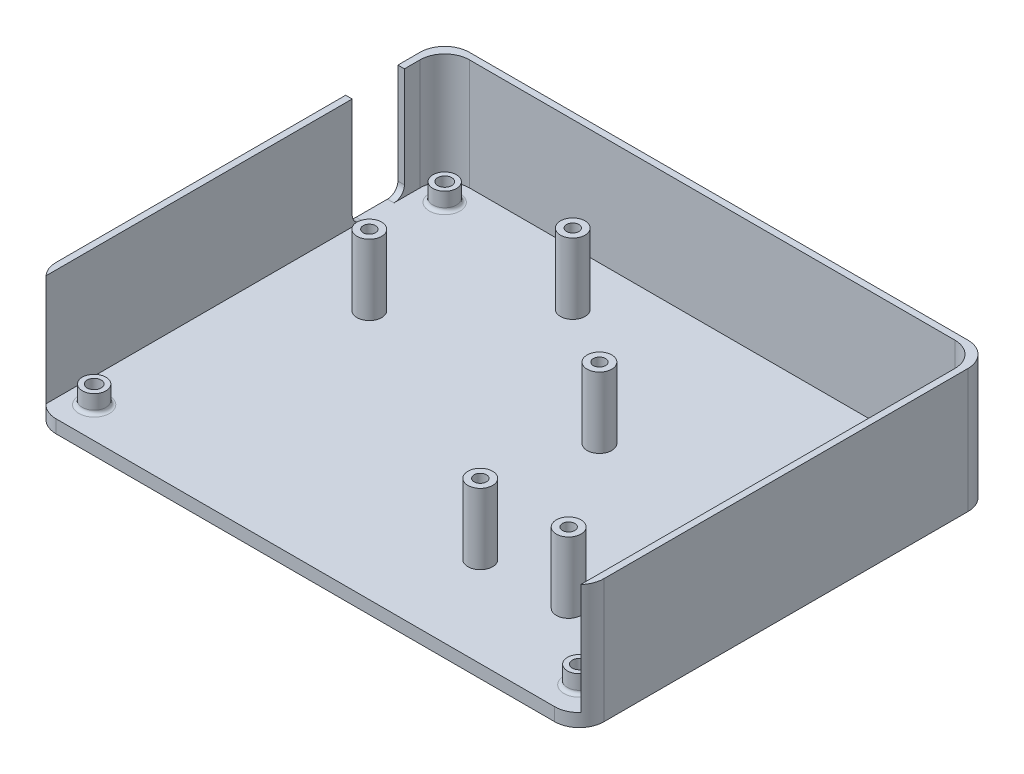
from build123d import *

# Parameters (mm, degrees)
BOSS_EXTRUDE12_DEPTH = 3.175
BOSS_EXTRUDE13_DEPTH = 30.1625
SKETCH1_25_R         = 2.875
SKETCH1_25_R_2       = 1.7
BOSS_EXTRUDE15_DEPTH = 7.525
SKETCH1_27_R         = 1.7
CUT_EXTRUDE3_DEPTH   = 28.575
CHAMFER2_SIZE        = 1.45
FILLET3_R            = 6
FILLET4_R            = 0.85
FILLET5_R            = 0.85
SKETCH2_W            = 12.7
SKETCH2_H            = 26.9875
CUT_EXTRUDE4_DEPTH   = 2.54
FILLET6_R            = 2.54
SKETCH1_30_R         = 3
SKETCH1_30_R_2       = 1.5
BOSS_EXTRUDE16_DEPTH = 20.32


with BuildPart() as part:
    # Sketch1 → Boss-Extrude12 (new body)
    with BuildSketch(Plane(origin=(0, 0, 0), x_dir=(1, 0, 0), z_dir=(0, 1, 0))):
        with BuildLine():
            Line((-66.858315384, -50.276221126), (-65.270815384, -50.276221126))
            Line((-65.270815384, -50.276221126), (64.85543465, -50.276221126))
            Line((64.85543465, -50.276221126), (66.44293465, -50.276221126))
            Line((66.44293465, -50.276221126), (66.44293465, 44.266274766))
            ThreePointArc((66.44293465, 44.266274766), (64.685575338, 48.508915454), (60.44293465, 50.266274766))
            Line((60.44293465, 50.266274766), (-60.858315384, 50.266274766))
            ThreePointArc((-60.858315384, 50.266274766), (-65.100956071, 48.508915454), (-66.858315384, 44.266274766))
            Line((-66.858315384, 44.266274766), (-66.858315384, -50.276221126))
        make_face()
    extrude(amount=BOSS_EXTRUDE12_DEPTH)

    # Sketch1<23> → Boss-Extrude13 (add)
    with BuildSketch(Plane(origin=(0, 0, 0), x_dir=(1, 0, 0), z_dir=(0, 1, 0))):
        with BuildLine():
            Line((-66.858315384, 44.266274766), (-66.858315384, -50.276221126))
            Line((-66.858315384, -50.276221126), (-65.270815384, -50.276221126))
            Line((-65.270815384, -50.276221126), (-65.270815384, 42.678774766))
            ThreePointArc((-65.270815384, 42.678774766), (-63.513456071, 46.921415454), (-59.270815384, 48.678774766))
            Line((-59.270815384, 48.678774766), (58.85543465, 48.678774766))
            ThreePointArc((58.85543465, 48.678774766), (63.098075338, 46.921415454), (64.85543465, 42.678774766))
            Line((64.85543465, 42.678774766), (64.85543465, -50.276221126))
            Line((64.85543465, -50.276221126), (66.44293465, -50.276221126))
            Line((66.44293465, -50.276221126), (66.44293465, 44.266274766))
            ThreePointArc((66.44293465, 44.266274766), (64.685575338, 48.508915454), (60.44293465, 50.266274766))
            Line((60.44293465, 50.266274766), (-60.858315384, 50.266274766))
            ThreePointArc((-60.858315384, 50.266274766), (-65.100956071, 48.508915454), (-66.858315384, 44.266274766))
        make_face()
    extrude(amount=BOSS_EXTRUDE13_DEPTH)

    # Sketch1<25> → Boss-Extrude15 (add)
    # profile 1 of 4: a face of its own
    with BuildSketch(Plane(origin=(0, 0, 0), x_dir=(1, 0, 0), z_dir=(0, 1, 0))):
        with Locations((-59.238315384, 42.646274766)):
            Circle(SKETCH1_25_R)
        with Locations((-59.238315384, 42.646274766)):
            Circle(SKETCH1_25_R_2, mode=Mode.SUBTRACT)
    # profile 2 of 4: a face of its own
    with BuildSketch(Plane(origin=(0, 0, 0), x_dir=(1, 0, 0), z_dir=(0, 1, 0))):
        with Locations((58.82293465, 42.646274766)):
            Circle(SKETCH1_25_R)
        with Locations((58.82293465, 42.646274766)):
            Circle(SKETCH1_25_R_2, mode=Mode.SUBTRACT)
    # profile 3 of 4: a face of its own
    with BuildSketch(Plane(origin=(0, 0, 0), x_dir=(1, 0, 0), z_dir=(0, 1, 0))):
        with Locations((-59.238315384, -42.656221126)):
            Circle(SKETCH1_25_R)
        with Locations((-59.238315384, -42.656221126)):
            Circle(SKETCH1_25_R_2, mode=Mode.SUBTRACT)
    # profile 4 of 4: a face of its own
    with BuildSketch(Plane(origin=(0, 0, 0), x_dir=(1, 0, 0), z_dir=(0, 1, 0))):
        with Locations((58.82293465, -42.656221126)):
            Circle(SKETCH1_25_R)
        with Locations((58.82293465, -42.656221126)):
            Circle(SKETCH1_25_R_2, mode=Mode.SUBTRACT)
    extrude(amount=BOSS_EXTRUDE15_DEPTH)

    # Sketch1<27> → Cut-Extrude3 (cut)
    with BuildSketch(Plane(origin=(0, 0, 0), x_dir=(1, 0, 0), z_dir=(0, 1, 0))):
        with Locations((-59.238315384, 42.646274766)):
            Circle(SKETCH1_27_R)
        with Locations((58.82293465, 42.646274766)):
            Circle(SKETCH1_27_R)
        with Locations((-59.238315384, -42.656221126)):
            Circle(SKETCH1_27_R)
        with Locations((58.82293465, -42.656221126)):
            Circle(SKETCH1_27_R)
    extrude(amount=CUT_EXTRUDE3_DEPTH, mode=Mode.SUBTRACT)

    # Chamfer2
    chamfer2_edges = [part.edges().sort_by_distance(p)[0] for p in [
        (57.12293465, 0, 42.656221126),
        (57.12293465, 0, -42.646274766),
        (-60.938315384, 0, 42.656221126),
        (-60.938315384, 0, -42.646274766),
    ]]
    chamfer(chamfer2_edges, length=CHAMFER2_SIZE)

    # Fillet3
    fillet3_edges = [part.edges().sort_by_distance(p)[0] for p in [
        (66.44293465, 15.08125, 50.276221126),
        (-66.858315384, 15.08125, 50.276221126),
    ]]
    fillet(fillet3_edges, radius=FILLET3_R)

    # Fillet4
    fillet4_edges = [part.edges().sort_by_distance(p)[0] for p in [
        (-62.113315384, 3.175, -42.646274766),
    ]]
    fillet(fillet4_edges, radius=FILLET4_R)

    # Fillet5
    fillet5_edges = [part.edges().sort_by_distance(p)[0] for p in [
        (-62.113315384, 3.175, 42.656221126),
        (55.94793465, 3.175, 42.656221126),
        (55.94793465, 3.175, -42.646274766),
    ]]
    fillet(fillet5_edges, radius=FILLET5_R)

    # Sketch2 → Cut-Extrude4 (cut)
    with BuildSketch(Plane(origin=(-65.270815384, 0, 0), x_dir=(0, 0, -1), z_dir=(1, 0, 0))):
        with Locations((32.519846941, 16.66875)):
            Rectangle(SKETCH2_W, SKETCH2_H)
    extrude(amount=-CUT_EXTRUDE4_DEPTH, mode=Mode.SUBTRACT)

    # Fillet6
    fillet6_edges = [part.edges().sort_by_distance(p)[0] for p in [
        (-66.064565384, 3.175, -38.869846941),
        (-66.064565384, 3.175, -26.169846941),
    ]]
    fillet(fillet6_edges, radius=FILLET6_R)

    # Sketch1<30> → Boss-Extrude16 (add)
    # profile 1 of 5: a face of its own
    with BuildSketch(Plane(origin=(0, 0, 0), x_dir=(1, 0, 0), z_dir=(0, 1, 0))):
        with Locations((-45.587205324, 10.652944173)):
            Circle(SKETCH1_30_R)
        with Locations((-45.587205324, 10.652944173)):
            Circle(SKETCH1_30_R_2, mode=Mode.SUBTRACT)
    # profile 2 of 5: a face of its own
    with BuildSketch(Plane(origin=(0, 0, 0), x_dir=(1, 0, 0), z_dir=(0, 1, 0))):
        with Locations((-21.087205302, 35.652944211)):
            Circle(SKETCH1_30_R)
        with Locations((-21.087205302, 35.652944211)):
            Circle(SKETCH1_30_R_2, mode=Mode.SUBTRACT)
    # profile 3 of 5: a face of its own
    with BuildSketch(Plane(origin=(0, 0, 0), x_dir=(1, 0, 0), z_dir=(0, 1, 0))):
        with Locations((10.41279469, 10.652944173)):
            Circle(SKETCH1_30_R)
        with Locations((10.41279469, 10.652944173)):
            Circle(SKETCH1_30_R_2, mode=Mode.SUBTRACT)
    # profile 4 of 5: a face of its own
    with BuildSketch(Plane(origin=(0, 0, 0), x_dir=(1, 0, 0), z_dir=(0, 1, 0))):
        with Locations((20.412794756, -28.347055805)):
            Circle(SKETCH1_30_R)
        with Locations((20.412794756, -28.347055805)):
            Circle(SKETCH1_30_R_2, mode=Mode.SUBTRACT)
    # profile 5 of 5: a face of its own
    with BuildSketch(Plane(origin=(0, 0, 0), x_dir=(1, 0, 0), z_dir=(0, 1, 0))):
        with Locations((41.412794666, -27.847055789)):
            Circle(SKETCH1_30_R)
        with Locations((41.412794666, -27.847055789)):
            Circle(SKETCH1_30_R_2, mode=Mode.SUBTRACT)
    extrude(amount=BOSS_EXTRUDE16_DEPTH)


solid = part.part
